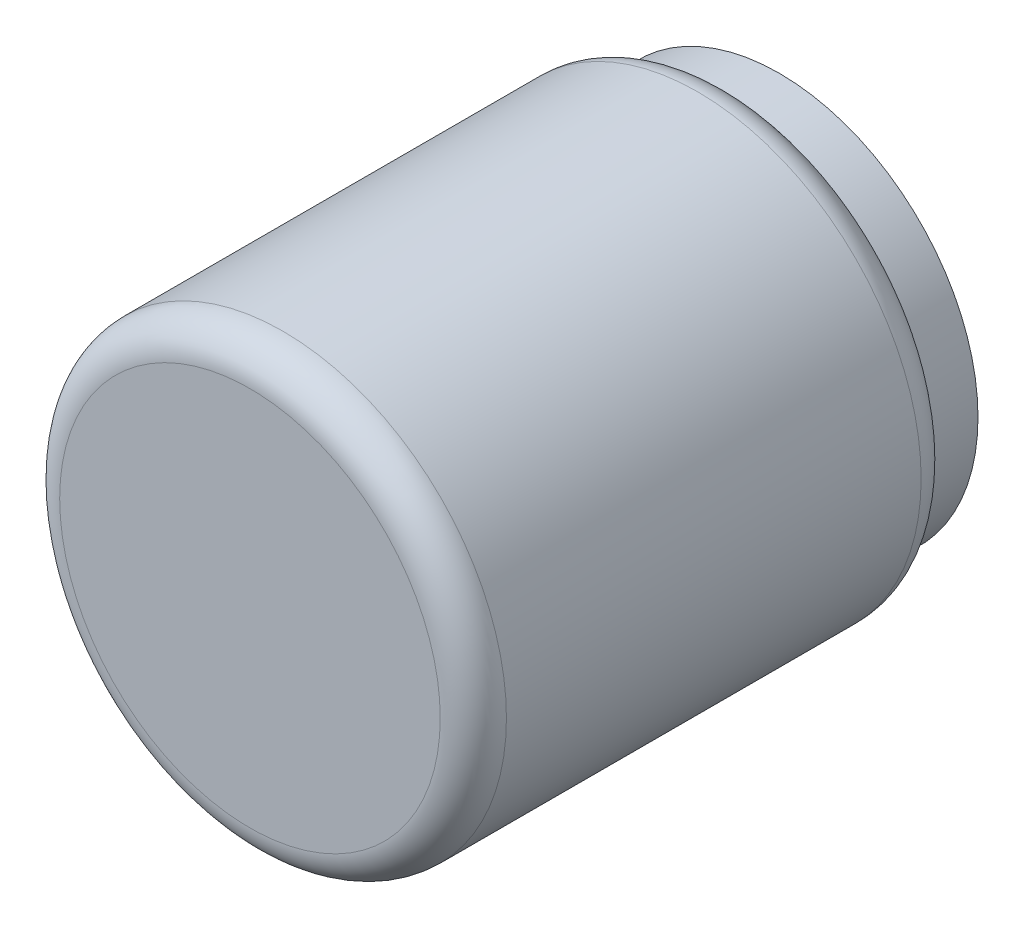
from build123d import *

# Parameters (mm, degrees)
SKETCH1_R           = 13.5
BOSS_EXTRUDE1_DEPTH = 32
FILLET1_R           = 2
SKETCH2_R           = 14.634398313
SKETCH2_R_2         = 12
CUT_EXTRUDE1_DEPTH  = 3
FILLET2_R           = 2


with BuildPart() as part:
    # Sketch1 → Boss-Extrude1 (new body)
    with BuildSketch(Plane.XY):
        Circle(SKETCH1_R)
    extrude(amount=BOSS_EXTRUDE1_DEPTH)

    # Fillet1
    fillet1_edges = [part.edges().sort_by_distance(p)[0] for p in [
        (-13.5, 0, 32),
    ]]
    fillet(fillet1_edges, radius=FILLET1_R)

    # Sketch2 → Cut-Extrude1 (cut)
    with BuildSketch(Plane(origin=(0, 0, 0), x_dir=(-1, 0, 0), z_dir=(0, 0, -1))):
        Circle(SKETCH2_R)
        Circle(SKETCH2_R_2, mode=Mode.SUBTRACT)
    extrude(amount=-CUT_EXTRUDE1_DEPTH, mode=Mode.SUBTRACT)

    # Fillet2
    # the kernel refuses this fillet: 2 mm, written as the material it takes off along each edge
    with BuildSketch(Plane(origin=(0, 0, 3), x_dir=(1, 0, 0), z_dir=(0, 1, 0))) as fillet2_piece_1:
        with BuildLine():
            CenterArc((11.5, -1.936491673), FILLET2_R, 0, 75.522487814)
            Line((12, 0), (12.01, 0.038729833))
            ThreePointArc((12.01, 0.038729833), (12.75, 0.04), (13.5, 0.04))
            Line((13.5, 0.04), (13.54, 0))
            Line((13.54, 0), (13.54, -1.936491673))
            Line((13.54, -1.936491673), (13.5, -1.936491673))
        make_face()
    revolve(axis=Axis((0, 0, 3), (0, 0, -1)), mode=Mode.SUBTRACT)


solid = part.part
